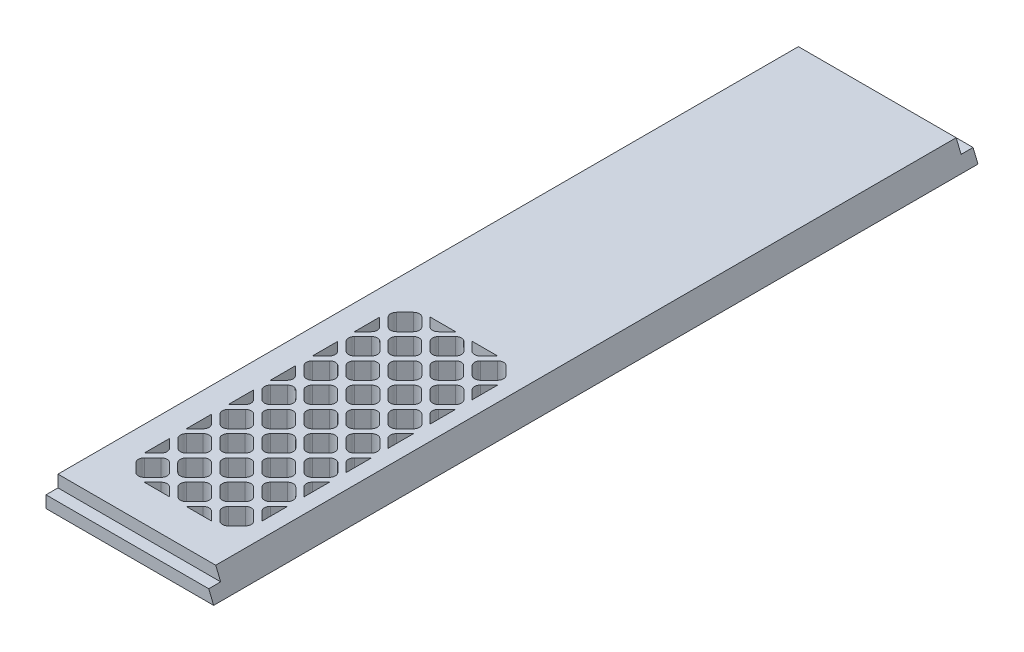
from build123d import *

# Parameters (mm, degrees)
BOSS_EXTRUDE1_DEPTH = 406.4
SKETCH2_W           = 89.154
SKETCH2_H           = 6.35
CUT_EXTRUDE1_DEPTH  = 6.35
CUT_EXTRUDE3_DEPTH  = 417.257955739


with BuildPart() as part:
    # Sketch1 → Boss-Extrude1 (new body)
    with BuildSketch(Plane.XY):
        Polygon((0, 0), (0, 12.7), (83.893487758, 12.7), (89.154, 0), align=None)
    extrude(amount=BOSS_EXTRUDE1_DEPTH)

    # Sketch2 → Cut-Extrude1 (cut)
    with BuildSketch(Plane.XZ.offset(-12.7)):
        with Locations((44.577, 3.175)):
            Rectangle(SKETCH2_W, SKETCH2_H)
        with Locations((44.577, 403.225)):
            Rectangle(SKETCH2_W, SKETCH2_H)
    extrude(amount=CUT_EXTRUDE1_DEPTH, mode=Mode.SUBTRACT)

    # Sketch3 → Cut-Extrude3 (cut, through all)
    with BuildSketch(Plane.XZ):
        with BuildLine():
            Line((19.97993597, 378.591192091), (15.489807909, 374.10106403))
            ThreePointArc((15.489807909, 374.10106403), (14.559871939, 371.856), (15.489807909, 369.61093597))
            Line((15.489807909, 369.61093597), (19.97993597, 365.120807909))
            ThreePointArc((19.97993597, 365.120807909), (22.225, 364.190871939), (24.47006403, 365.120807909))
            Line((24.47006403, 365.120807909), (28.960192091, 369.61093597))
            ThreePointArc((28.960192091, 369.61093597), (29.890128061, 371.856), (28.960192091, 374.10106403))
            Line((28.960192091, 374.10106403), (24.47006403, 378.591192091))
            ThreePointArc((24.47006403, 378.591192091), (22.225, 379.521128061), (19.97993597, 378.591192091))
        make_face()
        with BuildLine():
            Line((40.086871939, 380.836256121), (26.616487758, 380.836256121))
            Line((26.616487758, 380.836256121), (31.106615818, 376.346128061))
            ThreePointArc((31.106615818, 376.346128061), (33.351679849, 375.416192091), (35.596743879, 376.346128061))
            Line((35.596743879, 376.346128061), (40.086871939, 380.836256121))
        make_face()
        with BuildLine():
            Line((17.734871939, 362.974384182), (13.244743879, 367.464512242))
            Line((13.244743879, 367.464512242), (13.244743879, 353.994128061))
            Line((13.244743879, 353.994128061), (17.734871939, 358.484256121))
            ThreePointArc((17.734871939, 358.484256121), (18.664807909, 360.729320151), (17.734871939, 362.974384182))
        make_face()
        with BuildLine():
            Line((62.438871939, 380.836256121), (48.968487758, 380.836256121))
            Line((48.968487758, 380.836256121), (53.458615818, 376.346128061))
            ThreePointArc((53.458615818, 376.346128061), (55.703679849, 375.416192091), (57.948743879, 376.346128061))
            Line((57.948743879, 376.346128061), (62.438871939, 380.836256121))
        make_face()
        with BuildLine():
            Line((17.734871939, 340.622384182), (13.244743879, 345.112512242))
            Line((13.244743879, 345.112512242), (13.244743879, 331.642128061))
            Line((13.244743879, 331.642128061), (17.734871939, 336.132256121))
            ThreePointArc((17.734871939, 336.132256121), (18.664807909, 338.377320151), (17.734871939, 340.622384182))
        make_face()
        with BuildLine():
            Line((17.734871939, 318.270384182), (13.244743879, 322.760512242))
            Line((13.244743879, 322.760512242), (13.244743879, 309.290128061))
            Line((13.244743879, 309.290128061), (17.734871939, 313.780256121))
            ThreePointArc((17.734871939, 313.780256121), (18.664807909, 316.025320151), (17.734871939, 318.270384182))
        make_face()
        with BuildLine():
            Line((17.734871939, 295.918384182), (13.244743879, 300.408512242))
            Line((13.244743879, 300.408512242), (13.244743879, 286.938128061))
            Line((13.244743879, 286.938128061), (17.734871939, 291.428256121))
            ThreePointArc((17.734871939, 291.428256121), (18.664807909, 293.673320151), (17.734871939, 295.918384182))
        make_face()
        with BuildLine():
            Line((75.909256121, 353.89964295), (75.909256121, 367.558997353))
            ThreePointArc((75.909256121, 367.558997353), (75.859427805, 367.51228531), (75.810615818, 367.464512242))
            Line((75.810615818, 367.464512242), (71.320487758, 362.974384182))
            ThreePointArc((71.320487758, 362.974384182), (70.390551788, 360.729320151), (71.320487758, 358.484256121))
            Line((71.320487758, 358.484256121), (75.810615818, 353.994128061))
            ThreePointArc((75.810615818, 353.994128061), (75.859427805, 353.946354993), (75.909256121, 353.89964295))
        make_face()
        with BuildLine():
            Line((17.734871939, 273.566384182), (13.244743879, 278.056512242))
            Line((13.244743879, 278.056512242), (13.244743879, 264.586128061))
            Line((13.244743879, 264.586128061), (17.734871939, 269.076256121))
            ThreePointArc((17.734871939, 269.076256121), (18.664807909, 271.321320151), (17.734871939, 273.566384182))
        make_face()
        with BuildLine():
            Line((75.909256121, 331.54764295), (75.909256121, 345.206997353))
            ThreePointArc((75.909256121, 345.206997353), (75.859427805, 345.16028531), (75.810615818, 345.112512242))
            Line((75.810615818, 345.112512242), (71.320487758, 340.622384182))
            ThreePointArc((71.320487758, 340.622384182), (70.390551788, 338.377320151), (71.320487758, 336.132256121))
            Line((71.320487758, 336.132256121), (75.810615818, 331.642128061))
            ThreePointArc((75.810615818, 331.642128061), (75.859427805, 331.594354993), (75.909256121, 331.54764295))
        make_face()
        with BuildLine():
            Line((17.734871939, 251.214384182), (13.244743879, 255.704512242))
            Line((13.244743879, 255.704512242), (13.244743879, 242.234128061))
            Line((13.244743879, 242.234128061), (17.734871939, 246.724256121))
            ThreePointArc((17.734871939, 246.724256121), (18.664807909, 248.969320151), (17.734871939, 251.214384182))
        make_face()
        with BuildLine():
            Line((75.909256121, 309.19564295), (75.909256121, 322.854997353))
            ThreePointArc((75.909256121, 322.854997353), (75.859427805, 322.80828531), (75.810615818, 322.760512242))
            Line((75.810615818, 322.760512242), (71.320487758, 318.270384182))
            ThreePointArc((71.320487758, 318.270384182), (70.390551788, 316.025320151), (71.320487758, 313.780256121))
            Line((71.320487758, 313.780256121), (75.810615818, 309.290128061))
            ThreePointArc((75.810615818, 309.290128061), (75.859427805, 309.242354993), (75.909256121, 309.19564295))
        make_face()
        with BuildLine():
            Line((75.909256121, 286.84364295), (75.909256121, 300.502997353))
            ThreePointArc((75.909256121, 300.502997353), (75.859427805, 300.45628531), (75.810615818, 300.408512242))
            Line((75.810615818, 300.408512242), (71.320487758, 295.918384182))
            ThreePointArc((71.320487758, 295.918384182), (70.390551788, 293.673320151), (71.320487758, 291.428256121))
            Line((71.320487758, 291.428256121), (75.810615818, 286.938128061))
            ThreePointArc((75.810615818, 286.938128061), (75.859427805, 286.890354993), (75.909256121, 286.84364295))
        make_face()
        with BuildLine():
            Line((75.909256121, 264.49164295), (75.909256121, 278.150997353))
            ThreePointArc((75.909256121, 278.150997353), (75.859427805, 278.10428531), (75.810615818, 278.056512242))
            Line((75.810615818, 278.056512242), (71.320487758, 273.566384182))
            ThreePointArc((71.320487758, 273.566384182), (70.390551788, 271.321320151), (71.320487758, 269.076256121))
            Line((71.320487758, 269.076256121), (75.810615818, 264.586128061))
            ThreePointArc((75.810615818, 264.586128061), (75.859427805, 264.538354993), (75.909256121, 264.49164295))
        make_face()
        with BuildLine():
            ThreePointArc((26.616487758, 228.862384182), (26.56871469, 228.813572195), (26.522002647, 228.763743879))
            Line((26.522002647, 228.763743879), (40.18135705, 228.763743879))
            ThreePointArc((40.18135705, 228.763743879), (40.134645007, 228.813572195), (40.086871939, 228.862384182))
            Line((40.086871939, 228.862384182), (35.596743879, 233.352512242))
            ThreePointArc((35.596743879, 233.352512242), (33.351679849, 234.282448212), (31.106615818, 233.352512242))
            Line((31.106615818, 233.352512242), (26.616487758, 228.862384182))
        make_face()
        with BuildLine():
            Line((75.909256121, 242.13964295), (75.909256121, 255.798997353))
            ThreePointArc((75.909256121, 255.798997353), (75.859427805, 255.75228531), (75.810615818, 255.704512242))
            Line((75.810615818, 255.704512242), (71.320487758, 251.214384182))
            ThreePointArc((71.320487758, 251.214384182), (70.390551788, 248.969320151), (71.320487758, 246.724256121))
            Line((71.320487758, 246.724256121), (75.810615818, 242.234128061))
            ThreePointArc((75.810615818, 242.234128061), (75.859427805, 242.186354993), (75.909256121, 242.13964295))
        make_face()
        with BuildLine():
            ThreePointArc((48.968487758, 228.862384182), (48.92071469, 228.813572195), (48.874002647, 228.763743879))
            Line((48.874002647, 228.763743879), (62.53335705, 228.763743879))
            ThreePointArc((62.53335705, 228.763743879), (62.486645007, 228.813572195), (62.438871939, 228.862384182))
            Line((62.438871939, 228.862384182), (57.948743879, 233.352512242))
            ThreePointArc((57.948743879, 233.352512242), (55.703679849, 234.282448212), (53.458615818, 233.352512242))
            Line((53.458615818, 233.352512242), (48.968487758, 228.862384182))
        make_face()
        with BuildLine():
            Line((37.841807909, 369.61093597), (42.33193597, 365.120807909))
            ThreePointArc((42.33193597, 365.120807909), (44.577, 364.190871939), (46.82206403, 365.120807909))
            Line((46.82206403, 365.120807909), (51.312192091, 369.61093597))
            ThreePointArc((51.312192091, 369.61093597), (52.242128061, 371.856), (51.312192091, 374.10106403))
            Line((51.312192091, 374.10106403), (46.82206403, 378.591192091))
            ThreePointArc((46.82206403, 378.591192091), (44.577, 379.521128061), (42.33193597, 378.591192091))
            Line((42.33193597, 378.591192091), (37.841807909, 374.10106403))
            ThreePointArc((37.841807909, 374.10106403), (36.911871939, 371.856), (37.841807909, 369.61093597))
        make_face()
        with BuildLine():
            Line((60.193807909, 369.61093597), (64.68393597, 365.120807909))
            ThreePointArc((64.68393597, 365.120807909), (66.929, 364.190871939), (69.17406403, 365.120807909))
            Line((69.17406403, 365.120807909), (73.664192091, 369.61093597))
            ThreePointArc((73.664192091, 369.61093597), (74.594128061, 371.856), (73.664192091, 374.10106403))
            Line((73.664192091, 374.10106403), (69.17406403, 378.591192091))
            ThreePointArc((69.17406403, 378.591192091), (66.929, 379.521128061), (64.68393597, 378.591192091))
            Line((64.68393597, 378.591192091), (60.193807909, 374.10106403))
            ThreePointArc((60.193807909, 374.10106403), (59.263871939, 371.856), (60.193807909, 369.61093597))
        make_face()
        with BuildLine():
            Line((15.489807909, 347.25893597), (19.97993597, 342.768807909))
            ThreePointArc((19.97993597, 342.768807909), (22.225, 341.838871939), (24.47006403, 342.768807909))
            Line((24.47006403, 342.768807909), (28.960192091, 347.25893597))
            ThreePointArc((28.960192091, 347.25893597), (29.890128061, 349.504), (28.960192091, 351.74906403))
            Line((28.960192091, 351.74906403), (24.47006403, 356.239192091))
            ThreePointArc((24.47006403, 356.239192091), (22.225, 357.169128061), (19.97993597, 356.239192091))
            Line((19.97993597, 356.239192091), (15.489807909, 351.74906403))
            ThreePointArc((15.489807909, 351.74906403), (14.559871939, 349.504), (15.489807909, 347.25893597))
        make_face()
        with BuildLine():
            Line((37.841807909, 347.25893597), (42.33193597, 342.768807909))
            ThreePointArc((42.33193597, 342.768807909), (44.577, 341.838871939), (46.82206403, 342.768807909))
            Line((46.82206403, 342.768807909), (51.312192091, 347.25893597))
            ThreePointArc((51.312192091, 347.25893597), (52.242128061, 349.504), (51.312192091, 351.74906403))
            Line((51.312192091, 351.74906403), (46.82206403, 356.239192091))
            ThreePointArc((46.82206403, 356.239192091), (44.577, 357.169128061), (42.33193597, 356.239192091))
            Line((42.33193597, 356.239192091), (37.841807909, 351.74906403))
            ThreePointArc((37.841807909, 351.74906403), (36.911871939, 349.504), (37.841807909, 347.25893597))
        make_face()
        with BuildLine():
            Line((60.193807909, 347.25893597), (64.68393597, 342.768807909))
            ThreePointArc((64.68393597, 342.768807909), (66.929, 341.838871939), (69.17406403, 342.768807909))
            Line((69.17406403, 342.768807909), (73.664192091, 347.25893597))
            ThreePointArc((73.664192091, 347.25893597), (74.594128061, 349.504), (73.664192091, 351.74906403))
            Line((73.664192091, 351.74906403), (69.17406403, 356.239192091))
            ThreePointArc((69.17406403, 356.239192091), (66.929, 357.169128061), (64.68393597, 356.239192091))
            Line((64.68393597, 356.239192091), (60.193807909, 351.74906403))
            ThreePointArc((60.193807909, 351.74906403), (59.263871939, 349.504), (60.193807909, 347.25893597))
        make_face()
        with BuildLine():
            Line((15.489807909, 324.90693597), (19.97993597, 320.416807909))
            ThreePointArc((19.97993597, 320.416807909), (22.225, 319.486871939), (24.47006403, 320.416807909))
            Line((24.47006403, 320.416807909), (28.960192091, 324.90693597))
            ThreePointArc((28.960192091, 324.90693597), (29.890128061, 327.152), (28.960192091, 329.39706403))
            Line((28.960192091, 329.39706403), (24.47006403, 333.887192091))
            ThreePointArc((24.47006403, 333.887192091), (22.225, 334.817128061), (19.97993597, 333.887192091))
            Line((19.97993597, 333.887192091), (15.489807909, 329.39706403))
            ThreePointArc((15.489807909, 329.39706403), (14.559871939, 327.152), (15.489807909, 324.90693597))
        make_face()
        with BuildLine():
            Line((37.841807909, 324.90693597), (42.33193597, 320.416807909))
            ThreePointArc((42.33193597, 320.416807909), (44.577, 319.486871939), (46.82206403, 320.416807909))
            Line((46.82206403, 320.416807909), (51.312192091, 324.90693597))
            ThreePointArc((51.312192091, 324.90693597), (52.242128061, 327.152), (51.312192091, 329.39706403))
            Line((51.312192091, 329.39706403), (46.82206403, 333.887192091))
            ThreePointArc((46.82206403, 333.887192091), (44.577, 334.817128061), (42.33193597, 333.887192091))
            Line((42.33193597, 333.887192091), (37.841807909, 329.39706403))
            ThreePointArc((37.841807909, 329.39706403), (36.911871939, 327.152), (37.841807909, 324.90693597))
        make_face()
        with BuildLine():
            Line((60.193807909, 324.90693597), (64.68393597, 320.416807909))
            ThreePointArc((64.68393597, 320.416807909), (66.929, 319.486871939), (69.17406403, 320.416807909))
            Line((69.17406403, 320.416807909), (73.664192091, 324.90693597))
            ThreePointArc((73.664192091, 324.90693597), (74.594128061, 327.152), (73.664192091, 329.39706403))
            Line((73.664192091, 329.39706403), (69.17406403, 333.887192091))
            ThreePointArc((69.17406403, 333.887192091), (66.929, 334.817128061), (64.68393597, 333.887192091))
            Line((64.68393597, 333.887192091), (60.193807909, 329.39706403))
            ThreePointArc((60.193807909, 329.39706403), (59.263871939, 327.152), (60.193807909, 324.90693597))
        make_face()
        with BuildLine():
            Line((15.489807909, 302.55493597), (19.97993597, 298.064807909))
            ThreePointArc((19.97993597, 298.064807909), (22.225, 297.134871939), (24.47006403, 298.064807909))
            Line((24.47006403, 298.064807909), (28.960192091, 302.55493597))
            ThreePointArc((28.960192091, 302.55493597), (29.890128061, 304.8), (28.960192091, 307.04506403))
            Line((28.960192091, 307.04506403), (24.47006403, 311.535192091))
            ThreePointArc((24.47006403, 311.535192091), (22.225, 312.465128061), (19.97993597, 311.535192091))
            Line((19.97993597, 311.535192091), (15.489807909, 307.04506403))
            ThreePointArc((15.489807909, 307.04506403), (14.559871939, 304.8), (15.489807909, 302.55493597))
        make_face()
        with BuildLine():
            Line((37.841807909, 302.55493597), (42.33193597, 298.064807909))
            ThreePointArc((42.33193597, 298.064807909), (44.577, 297.134871939), (46.82206403, 298.064807909))
            Line((46.82206403, 298.064807909), (51.312192091, 302.55493597))
            ThreePointArc((51.312192091, 302.55493597), (52.242128061, 304.8), (51.312192091, 307.04506403))
            Line((51.312192091, 307.04506403), (46.82206403, 311.535192091))
            ThreePointArc((46.82206403, 311.535192091), (44.577, 312.465128061), (42.33193597, 311.535192091))
            Line((42.33193597, 311.535192091), (37.841807909, 307.04506403))
            ThreePointArc((37.841807909, 307.04506403), (36.911871939, 304.8), (37.841807909, 302.55493597))
        make_face()
        with BuildLine():
            Line((60.193807909, 302.55493597), (64.68393597, 298.064807909))
            ThreePointArc((64.68393597, 298.064807909), (66.929, 297.134871939), (69.17406403, 298.064807909))
            Line((69.17406403, 298.064807909), (73.664192091, 302.55493597))
            ThreePointArc((73.664192091, 302.55493597), (74.594128061, 304.8), (73.664192091, 307.04506403))
            Line((73.664192091, 307.04506403), (69.17406403, 311.535192091))
            ThreePointArc((69.17406403, 311.535192091), (66.929, 312.465128061), (64.68393597, 311.535192091))
            Line((64.68393597, 311.535192091), (60.193807909, 307.04506403))
            ThreePointArc((60.193807909, 307.04506403), (59.263871939, 304.8), (60.193807909, 302.55493597))
        make_face()
        with BuildLine():
            Line((15.489807909, 280.20293597), (19.97993597, 275.712807909))
            ThreePointArc((19.97993597, 275.712807909), (22.225, 274.782871939), (24.47006403, 275.712807909))
            Line((24.47006403, 275.712807909), (28.960192091, 280.20293597))
            ThreePointArc((28.960192091, 280.20293597), (29.890128061, 282.448), (28.960192091, 284.69306403))
            Line((28.960192091, 284.69306403), (24.47006403, 289.183192091))
            ThreePointArc((24.47006403, 289.183192091), (22.225, 290.113128061), (19.97993597, 289.183192091))
            Line((19.97993597, 289.183192091), (15.489807909, 284.69306403))
            ThreePointArc((15.489807909, 284.69306403), (14.559871939, 282.448), (15.489807909, 280.20293597))
        make_face()
        with BuildLine():
            Line((37.841807909, 280.20293597), (42.33193597, 275.712807909))
            ThreePointArc((42.33193597, 275.712807909), (44.577, 274.782871939), (46.82206403, 275.712807909))
            Line((46.82206403, 275.712807909), (51.312192091, 280.20293597))
            ThreePointArc((51.312192091, 280.20293597), (52.242128061, 282.448), (51.312192091, 284.69306403))
            Line((51.312192091, 284.69306403), (46.82206403, 289.183192091))
            ThreePointArc((46.82206403, 289.183192091), (44.577, 290.113128061), (42.33193597, 289.183192091))
            Line((42.33193597, 289.183192091), (37.841807909, 284.69306403))
            ThreePointArc((37.841807909, 284.69306403), (36.911871939, 282.448), (37.841807909, 280.20293597))
        make_face()
        with BuildLine():
            Line((60.193807909, 280.20293597), (64.68393597, 275.712807909))
            ThreePointArc((64.68393597, 275.712807909), (66.929, 274.782871939), (69.17406403, 275.712807909))
            Line((69.17406403, 275.712807909), (73.664192091, 280.20293597))
            ThreePointArc((73.664192091, 280.20293597), (74.594128061, 282.448), (73.664192091, 284.69306403))
            Line((73.664192091, 284.69306403), (69.17406403, 289.183192091))
            ThreePointArc((69.17406403, 289.183192091), (66.929, 290.113128061), (64.68393597, 289.183192091))
            Line((64.68393597, 289.183192091), (60.193807909, 284.69306403))
            ThreePointArc((60.193807909, 284.69306403), (59.263871939, 282.448), (60.193807909, 280.20293597))
        make_face()
        with BuildLine():
            Line((15.489807909, 257.85093597), (19.97993597, 253.360807909))
            ThreePointArc((19.97993597, 253.360807909), (22.225, 252.430871939), (24.47006403, 253.360807909))
            Line((24.47006403, 253.360807909), (28.960192091, 257.85093597))
            ThreePointArc((28.960192091, 257.85093597), (29.890128061, 260.096), (28.960192091, 262.34106403))
            Line((28.960192091, 262.34106403), (24.47006403, 266.831192091))
            ThreePointArc((24.47006403, 266.831192091), (22.225, 267.761128061), (19.97993597, 266.831192091))
            Line((19.97993597, 266.831192091), (15.489807909, 262.34106403))
            ThreePointArc((15.489807909, 262.34106403), (14.559871939, 260.096), (15.489807909, 257.85093597))
        make_face()
        with BuildLine():
            Line((37.841807909, 257.85093597), (42.33193597, 253.360807909))
            ThreePointArc((42.33193597, 253.360807909), (44.577, 252.430871939), (46.82206403, 253.360807909))
            Line((46.82206403, 253.360807909), (51.312192091, 257.85093597))
            ThreePointArc((51.312192091, 257.85093597), (52.242128061, 260.096), (51.312192091, 262.34106403))
            Line((51.312192091, 262.34106403), (46.82206403, 266.831192091))
            ThreePointArc((46.82206403, 266.831192091), (44.577, 267.761128061), (42.33193597, 266.831192091))
            Line((42.33193597, 266.831192091), (37.841807909, 262.34106403))
            ThreePointArc((37.841807909, 262.34106403), (36.911871939, 260.096), (37.841807909, 257.85093597))
        make_face()
        with BuildLine():
            Line((60.193807909, 257.85093597), (64.68393597, 253.360807909))
            ThreePointArc((64.68393597, 253.360807909), (66.929, 252.430871939), (69.17406403, 253.360807909))
            Line((69.17406403, 253.360807909), (73.664192091, 257.85093597))
            ThreePointArc((73.664192091, 257.85093597), (74.594128061, 260.096), (73.664192091, 262.34106403))
            Line((73.664192091, 262.34106403), (69.17406403, 266.831192091))
            ThreePointArc((69.17406403, 266.831192091), (66.929, 267.761128061), (64.68393597, 266.831192091))
            Line((64.68393597, 266.831192091), (60.193807909, 262.34106403))
            ThreePointArc((60.193807909, 262.34106403), (59.263871939, 260.096), (60.193807909, 257.85093597))
        make_face()
        with BuildLine():
            Line((15.489807909, 235.49893597), (19.97993597, 231.008807909))
            ThreePointArc((19.97993597, 231.008807909), (22.225, 230.078871939), (24.47006403, 231.008807909))
            Line((24.47006403, 231.008807909), (28.960192091, 235.49893597))
            ThreePointArc((28.960192091, 235.49893597), (29.890128061, 237.744), (28.960192091, 239.98906403))
            Line((28.960192091, 239.98906403), (24.47006403, 244.479192091))
            ThreePointArc((24.47006403, 244.479192091), (22.225, 245.409128061), (19.97993597, 244.479192091))
            Line((19.97993597, 244.479192091), (15.489807909, 239.98906403))
            ThreePointArc((15.489807909, 239.98906403), (14.559871939, 237.744), (15.489807909, 235.49893597))
        make_face()
        with BuildLine():
            Line((37.841807909, 235.49893597), (42.33193597, 231.008807909))
            ThreePointArc((42.33193597, 231.008807909), (44.577, 230.078871939), (46.82206403, 231.008807909))
            Line((46.82206403, 231.008807909), (51.312192091, 235.49893597))
            ThreePointArc((51.312192091, 235.49893597), (52.242128061, 237.744), (51.312192091, 239.98906403))
            Line((51.312192091, 239.98906403), (46.82206403, 244.479192091))
            ThreePointArc((46.82206403, 244.479192091), (44.577, 245.409128061), (42.33193597, 244.479192091))
            Line((42.33193597, 244.479192091), (37.841807909, 239.98906403))
            ThreePointArc((37.841807909, 239.98906403), (36.911871939, 237.744), (37.841807909, 235.49893597))
        make_face()
        with BuildLine():
            Line((60.193807909, 235.49893597), (64.68393597, 231.008807909))
            ThreePointArc((64.68393597, 231.008807909), (66.929, 230.078871939), (69.17406403, 231.008807909))
            Line((69.17406403, 231.008807909), (73.664192091, 235.49893597))
            ThreePointArc((73.664192091, 235.49893597), (74.594128061, 237.744), (73.664192091, 239.98906403))
            Line((73.664192091, 239.98906403), (69.17406403, 244.479192091))
            ThreePointArc((69.17406403, 244.479192091), (66.929, 245.409128061), (64.68393597, 244.479192091))
            Line((64.68393597, 244.479192091), (60.193807909, 239.98906403))
            ThreePointArc((60.193807909, 239.98906403), (59.263871939, 237.744), (60.193807909, 235.49893597))
        make_face()
        with BuildLine():
            Line((31.106615818, 367.464512242), (26.616487758, 362.974384182))
            ThreePointArc((26.616487758, 362.974384182), (25.686551788, 360.729320151), (26.616487758, 358.484256121))
            Line((26.616487758, 358.484256121), (31.106615818, 353.994128061))
            ThreePointArc((31.106615818, 353.994128061), (33.351679849, 353.064192091), (35.596743879, 353.994128061))
            Line((35.596743879, 353.994128061), (40.086871939, 358.484256121))
            ThreePointArc((40.086871939, 358.484256121), (41.016807909, 360.729320151), (40.086871939, 362.974384182))
            Line((40.086871939, 362.974384182), (35.596743879, 367.464512242))
            ThreePointArc((35.596743879, 367.464512242), (33.351679849, 368.394448212), (31.106615818, 367.464512242))
        make_face()
        with BuildLine():
            Line((53.458615818, 367.464512242), (48.968487758, 362.974384182))
            ThreePointArc((48.968487758, 362.974384182), (48.038551788, 360.729320151), (48.968487758, 358.484256121))
            Line((48.968487758, 358.484256121), (53.458615818, 353.994128061))
            ThreePointArc((53.458615818, 353.994128061), (55.703679849, 353.064192091), (57.948743879, 353.994128061))
            Line((57.948743879, 353.994128061), (62.438871939, 358.484256121))
            ThreePointArc((62.438871939, 358.484256121), (63.368807909, 360.729320151), (62.438871939, 362.974384182))
            Line((62.438871939, 362.974384182), (57.948743879, 367.464512242))
            ThreePointArc((57.948743879, 367.464512242), (55.703679849, 368.394448212), (53.458615818, 367.464512242))
        make_face()
        with BuildLine():
            Line((31.106615818, 345.112512242), (26.616487758, 340.622384182))
            ThreePointArc((26.616487758, 340.622384182), (25.686551788, 338.377320151), (26.616487758, 336.132256121))
            Line((26.616487758, 336.132256121), (31.106615818, 331.642128061))
            ThreePointArc((31.106615818, 331.642128061), (33.351679849, 330.712192091), (35.596743879, 331.642128061))
            Line((35.596743879, 331.642128061), (40.086871939, 336.132256121))
            ThreePointArc((40.086871939, 336.132256121), (41.016807909, 338.377320151), (40.086871939, 340.622384182))
            Line((40.086871939, 340.622384182), (35.596743879, 345.112512242))
            ThreePointArc((35.596743879, 345.112512242), (33.351679849, 346.042448212), (31.106615818, 345.112512242))
        make_face()
        with BuildLine():
            Line((53.458615818, 345.112512242), (48.968487758, 340.622384182))
            ThreePointArc((48.968487758, 340.622384182), (48.038551788, 338.377320151), (48.968487758, 336.132256121))
            Line((48.968487758, 336.132256121), (53.458615818, 331.642128061))
            ThreePointArc((53.458615818, 331.642128061), (55.703679849, 330.712192091), (57.948743879, 331.642128061))
            Line((57.948743879, 331.642128061), (62.438871939, 336.132256121))
            ThreePointArc((62.438871939, 336.132256121), (63.368807909, 338.377320151), (62.438871939, 340.622384182))
            Line((62.438871939, 340.622384182), (57.948743879, 345.112512242))
            ThreePointArc((57.948743879, 345.112512242), (55.703679849, 346.042448212), (53.458615818, 345.112512242))
        make_face()
        with BuildLine():
            Line((31.106615818, 322.760512242), (26.616487758, 318.270384182))
            ThreePointArc((26.616487758, 318.270384182), (25.686551788, 316.025320151), (26.616487758, 313.780256121))
            Line((26.616487758, 313.780256121), (31.106615818, 309.290128061))
            ThreePointArc((31.106615818, 309.290128061), (33.351679849, 308.360192091), (35.596743879, 309.290128061))
            Line((35.596743879, 309.290128061), (40.086871939, 313.780256121))
            ThreePointArc((40.086871939, 313.780256121), (41.016807909, 316.025320151), (40.086871939, 318.270384182))
            Line((40.086871939, 318.270384182), (35.596743879, 322.760512242))
            ThreePointArc((35.596743879, 322.760512242), (33.351679849, 323.690448212), (31.106615818, 322.760512242))
        make_face()
        with BuildLine():
            Line((53.458615818, 322.760512242), (48.968487758, 318.270384182))
            ThreePointArc((48.968487758, 318.270384182), (48.038551788, 316.025320151), (48.968487758, 313.780256121))
            Line((48.968487758, 313.780256121), (53.458615818, 309.290128061))
            ThreePointArc((53.458615818, 309.290128061), (55.703679849, 308.360192091), (57.948743879, 309.290128061))
            Line((57.948743879, 309.290128061), (62.438871939, 313.780256121))
            ThreePointArc((62.438871939, 313.780256121), (63.368807909, 316.025320151), (62.438871939, 318.270384182))
            Line((62.438871939, 318.270384182), (57.948743879, 322.760512242))
            ThreePointArc((57.948743879, 322.760512242), (55.703679849, 323.690448212), (53.458615818, 322.760512242))
        make_face()
        with BuildLine():
            Line((31.106615818, 300.408512242), (26.616487758, 295.918384182))
            ThreePointArc((26.616487758, 295.918384182), (25.686551788, 293.673320151), (26.616487758, 291.428256121))
            Line((26.616487758, 291.428256121), (31.106615818, 286.938128061))
            ThreePointArc((31.106615818, 286.938128061), (33.351679849, 286.008192091), (35.596743879, 286.938128061))
            Line((35.596743879, 286.938128061), (40.086871939, 291.428256121))
            ThreePointArc((40.086871939, 291.428256121), (41.016807909, 293.673320151), (40.086871939, 295.918384182))
            Line((40.086871939, 295.918384182), (35.596743879, 300.408512242))
            ThreePointArc((35.596743879, 300.408512242), (33.351679849, 301.338448212), (31.106615818, 300.408512242))
        make_face()
        with BuildLine():
            Line((53.458615818, 300.408512242), (48.968487758, 295.918384182))
            ThreePointArc((48.968487758, 295.918384182), (48.038551788, 293.673320151), (48.968487758, 291.428256121))
            Line((48.968487758, 291.428256121), (53.458615818, 286.938128061))
            ThreePointArc((53.458615818, 286.938128061), (55.703679849, 286.008192091), (57.948743879, 286.938128061))
            Line((57.948743879, 286.938128061), (62.438871939, 291.428256121))
            ThreePointArc((62.438871939, 291.428256121), (63.368807909, 293.673320151), (62.438871939, 295.918384182))
            Line((62.438871939, 295.918384182), (57.948743879, 300.408512242))
            ThreePointArc((57.948743879, 300.408512242), (55.703679849, 301.338448212), (53.458615818, 300.408512242))
        make_face()
        with BuildLine():
            Line((31.106615818, 278.056512242), (26.616487758, 273.566384182))
            ThreePointArc((26.616487758, 273.566384182), (25.686551788, 271.321320151), (26.616487758, 269.076256121))
            Line((26.616487758, 269.076256121), (31.106615818, 264.586128061))
            ThreePointArc((31.106615818, 264.586128061), (33.351679849, 263.656192091), (35.596743879, 264.586128061))
            Line((35.596743879, 264.586128061), (40.086871939, 269.076256121))
            ThreePointArc((40.086871939, 269.076256121), (41.016807909, 271.321320151), (40.086871939, 273.566384182))
            Line((40.086871939, 273.566384182), (35.596743879, 278.056512242))
            ThreePointArc((35.596743879, 278.056512242), (33.351679849, 278.986448212), (31.106615818, 278.056512242))
        make_face()
        with BuildLine():
            Line((53.458615818, 278.056512242), (48.968487758, 273.566384182))
            ThreePointArc((48.968487758, 273.566384182), (48.038551788, 271.321320151), (48.968487758, 269.076256121))
            Line((48.968487758, 269.076256121), (53.458615818, 264.586128061))
            ThreePointArc((53.458615818, 264.586128061), (55.703679849, 263.656192091), (57.948743879, 264.586128061))
            Line((57.948743879, 264.586128061), (62.438871939, 269.076256121))
            ThreePointArc((62.438871939, 269.076256121), (63.368807909, 271.321320151), (62.438871939, 273.566384182))
            Line((62.438871939, 273.566384182), (57.948743879, 278.056512242))
            ThreePointArc((57.948743879, 278.056512242), (55.703679849, 278.986448212), (53.458615818, 278.056512242))
        make_face()
        with BuildLine():
            Line((31.106615818, 255.704512242), (26.616487758, 251.214384182))
            ThreePointArc((26.616487758, 251.214384182), (25.686551788, 248.969320151), (26.616487758, 246.724256121))
            Line((26.616487758, 246.724256121), (31.106615818, 242.234128061))
            ThreePointArc((31.106615818, 242.234128061), (33.351679849, 241.304192091), (35.596743879, 242.234128061))
            Line((35.596743879, 242.234128061), (40.086871939, 246.724256121))
            ThreePointArc((40.086871939, 246.724256121), (41.016807909, 248.969320151), (40.086871939, 251.214384182))
            Line((40.086871939, 251.214384182), (35.596743879, 255.704512242))
            ThreePointArc((35.596743879, 255.704512242), (33.351679849, 256.634448212), (31.106615818, 255.704512242))
        make_face()
        with BuildLine():
            Line((53.458615818, 255.704512242), (48.968487758, 251.214384182))
            ThreePointArc((48.968487758, 251.214384182), (48.038551788, 248.969320151), (48.968487758, 246.724256121))
            Line((48.968487758, 246.724256121), (53.458615818, 242.234128061))
            ThreePointArc((53.458615818, 242.234128061), (55.703679849, 241.304192091), (57.948743879, 242.234128061))
            Line((57.948743879, 242.234128061), (62.438871939, 246.724256121))
            ThreePointArc((62.438871939, 246.724256121), (63.368807909, 248.969320151), (62.438871939, 251.214384182))
            Line((62.438871939, 251.214384182), (57.948743879, 255.704512242))
            ThreePointArc((57.948743879, 255.704512242), (55.703679849, 256.634448212), (53.458615818, 255.704512242))
        make_face()
    extrude(amount=-CUT_EXTRUDE3_DEPTH, mode=Mode.SUBTRACT)


solid = part.part
